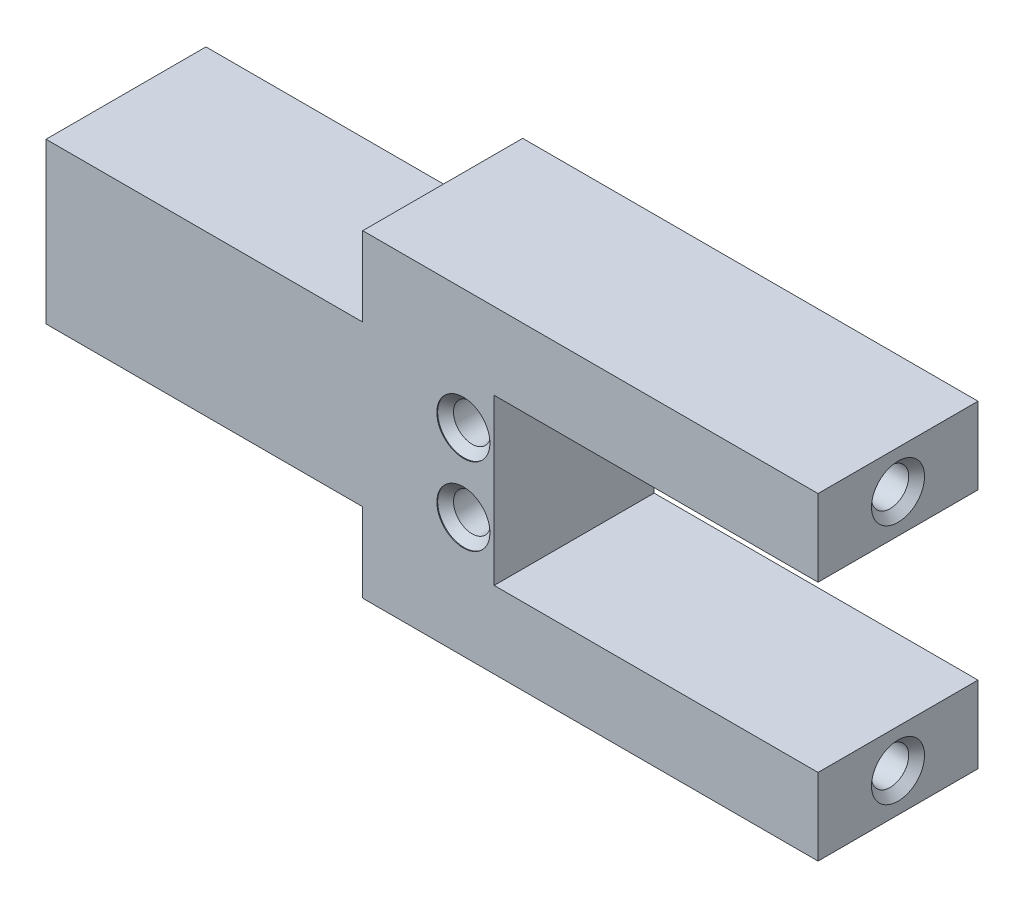
from build123d import *

# Parameters (mm, degrees)
SKETCH1_W           = 20
SKETCH1_H           = 20
BOSS_EXTRUDE1_DEPTH = 20
SKETCH2_W           = 20
SKETCH2_H           = 40.2
BOSS_EXTRUDE2_DEPTH = 64.7
SKETCH3_W           = 40.9
SKETCH3_H           = 20.8
CUT_EXTRUDE1_DEPTH  = 90.320210479
SKETCH4_W           = 11.9
SKETCH4_H           = 40.2
CUT_EXTRUDE2_DEPTH  = 90.320210479
SKETCH5_R           = 2.35
CUT_EXTRUDE3_DEPTH  = 10
SKETCH6_R           = 2.35
CUT_EXTRUDE4_DEPTH  = 10
CHAMFER1_SIZE       = 1
SKETCH7_W           = 20
SKETCH7_H           = 10.1
BOSS_EXTRUDE4_DEPTH = 4.7
SKETCH9_W           = 20
SKETCH9_H           = 20
BOSS_EXTRUDE5_DEPTH = 24.7
SKETCH10_R          = 3
CUT_EXTRUDE5_DEPTH  = 2
FILLET1_R           = 3.23
SKETCH11_W          = 20.2
SKETCH11_H          = 20.2
SKETCH11_W_2        = 20
SKETCH11_H_2        = 20
BOSS_EXTRUDE6_DEPTH = 40
SKETCH12_R          = 3.35
BOSS_EXTRUDE7_DEPTH = 0.1
BOSS_EXTRUDE8_DEPTH = 0.1


with BuildPart() as part:
    # Sketch1 → Boss-Extrude1 (new body)
    with BuildSketch(Plane(origin=(0, 0, 0), x_dir=(0, 0, -1), z_dir=(1, 0, 0))):
        Rectangle(SKETCH1_W, SKETCH1_H)
    extrude(amount=BOSS_EXTRUDE1_DEPTH)

    # Sketch2 → Boss-Extrude2 (add)
    with BuildSketch(Plane(origin=(20, 0, 0), x_dir=(0, 0, -1), z_dir=(1, 0, 0))):
        Rectangle(SKETCH2_W, SKETCH2_H)
    extrude(amount=BOSS_EXTRUDE2_DEPTH)

    # Sketch3 → Cut-Extrude1 (cut, through all)
    with BuildSketch(Plane.XY.offset(10)):
        with Locations((52.35, 0)):
            Rectangle(SKETCH3_W, SKETCH3_H)
    extrude(amount=-CUT_EXTRUDE1_DEPTH, mode=Mode.SUBTRACT)

    # Sketch4 → Cut-Extrude2 (cut, through all)
    with BuildSketch(Plane.XY.offset(10)):
        with Locations((78.75, 0)):
            Rectangle(SKETCH4_W, SKETCH4_H)
    extrude(amount=-CUT_EXTRUDE2_DEPTH, mode=Mode.SUBTRACT)

    # Sketch5 → Cut-Extrude3 (cut)
    with BuildSketch(Plane.XY.offset(10)):
        with Locations((28.01, 4.9)):
            Circle(SKETCH5_R)
        with Locations(Location((28.01, -4.9, 0), (0, 0, 180))):
            Circle(SKETCH5_R)
    extrude(amount=-CUT_EXTRUDE3_DEPTH, mode=Mode.SUBTRACT)

    # Sketch6 → Cut-Extrude4 (cut)
    with BuildSketch(Plane(origin=(72.8, 0, 0), x_dir=(0, 0, -1), z_dir=(1, 0, 0))):
        with Locations((0, -15.25)):
            Circle(SKETCH6_R)
        with Locations(Location((0, 15.25, 0), (0, 0, 180))):
            Circle(SKETCH6_R)
    extrude(amount=-CUT_EXTRUDE4_DEPTH, mode=Mode.SUBTRACT)

    # Chamfer1
    chamfer1_edges = [part.edges().sort_by_distance(p)[0] for p in [
        (25.66, 4.9, 10),
        (30.36, -4.9, 10),
        (72.8, -15.25, 2.35),
        (72.8, 15.25, -2.35),
    ]]
    chamfer(chamfer1_edges, length=CHAMFER1_SIZE)

    # Sketch7 → Boss-Extrude4 (add)
    with BuildSketch(Plane.ZY.offset(-20)):
        with Locations((0, 15.05)):
            Rectangle(SKETCH7_W, SKETCH7_H)
        with Locations((0, -15.05)):
            Rectangle(SKETCH7_W, SKETCH7_H)
    extrude(amount=BOSS_EXTRUDE4_DEPTH)

    # Sketch9 → Boss-Extrude5 (add)
    with BuildSketch(Plane.ZY):
        Rectangle(SKETCH9_W, SKETCH9_H)
    extrude(amount=BOSS_EXTRUDE5_DEPTH)

    # Sketch10 → Cut-Extrude5 (cut)
    with BuildSketch(Plane.ZY.offset(24.7)):
        Circle(SKETCH10_R)
    extrude(amount=-CUT_EXTRUDE5_DEPTH, mode=Mode.SUBTRACT)

    # Fillet1
    # the kernel refuses this fillet: 3.23 mm, written as the material it adds along each edge
    with BuildSketch(Plane(origin=(-22.7, 0, 0), x_dir=(0, 0, 1), z_dir=(0, -1, 0))) as fillet1_piece_1:
        with BuildLine():
            CenterArc((0.013363095, 3.23), FILLET1_R, 270, 67.616447755)
            Line((0.013363095, 0), (0.013363095, -0.0646))
            Line((0.013363095, -0.0646), (3, -0.0646))
            Line((3, -0.0646), (3.0646, 0))
            ThreePointArc((3.0646, 0), (3.0646, 1), (3.059732738, 1.9754))
            Line((3.059732738, 1.9754), (3, 2))
        make_face()
    revolve(axis=Axis((-22.7, 0, 0), (-1, 0, 0)))

    # Sketch11 → Boss-Extrude6 (add)
    with BuildSketch(Plane.ZY.offset(24.7)):
        Rectangle(SKETCH11_W, SKETCH11_H)
        Rectangle(SKETCH11_W_2, SKETCH11_H_2, mode=Mode.SUBTRACT)
    extrude(amount=-BOSS_EXTRUDE6_DEPTH)

    # Sketch12 → Boss-Extrude7 (add)
    with BuildSketch(Plane.XY.offset(10)):
        Polygon((72.8, 20.1), (15.3, 20.1), (15.3, -20.1), (72.8, -20.1), (72.8, -10.4), (31.9, -10.4), (31.9, 10.4), (72.8, 10.4), align=None)
        with Locations(Location((28.01, 4.9, 0), (0, 0, 180))):
            Circle(SKETCH12_R, mode=Mode.SUBTRACT)
        with Locations(Location((28.01, -4.9, 0), (0, 0, 180))):
            Circle(SKETCH12_R, mode=Mode.SUBTRACT)
    extrude(amount=BOSS_EXTRUDE7_DEPTH)

    # Sketch13 → Boss-Extrude8 (add)
    with BuildSketch(Plane(origin=(0, 0, -10), x_dir=(-1, 0, 0), z_dir=(0, 0, -1))):
        Polygon((-72.8, -20.1), (-15.3, -20.1), (-15.3, 20.1), (-72.8, 20.1), (-72.8, 10.4), (-31.9, 10.4), (-31.9, -10.4), (-72.8, -10.4), align=None)
    extrude(amount=BOSS_EXTRUDE8_DEPTH)


solid = part.part
